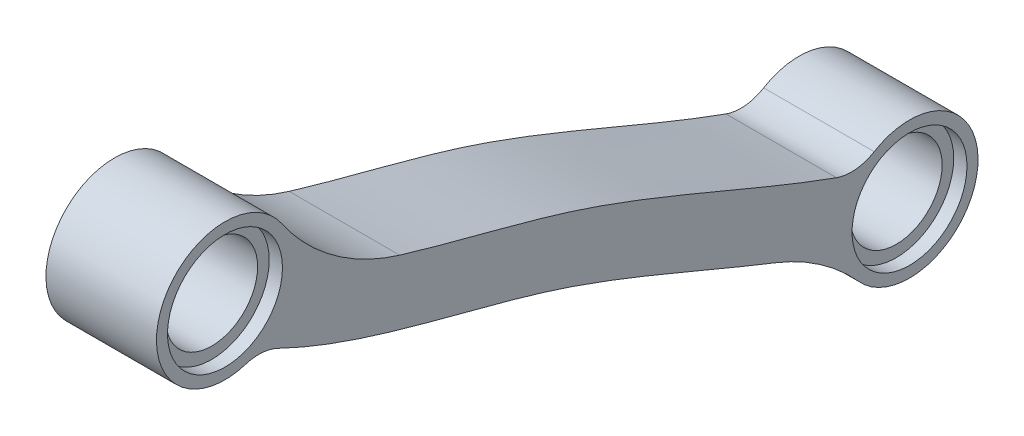
from build123d import *

# Parameters (mm, degrees)
BOSS_EXTRUDE1_START     = -2.5
BOSS_EXTRUDE1_OUTLINE_R = 2.075
BOSS_EXTRUDE1_DEPTH     = 5
FILLET1_R               = 10
FILLET2_R               = 2
SKETCH6_R               = 2.6
CUT_EXTRUDE3_DEPTH      = 0.6
CUT_EXTRUDE4_START      = -0.6
SKETCH7_R               = 2.6
CUT_EXTRUDE4_DEPTH      = 0.6


# Read off the part's stored shape, not the designer's step: Boss-Extrude1
with BuildPart() as part:
    # Boss-Extrude1 outline → Boss-Extrude1 (new body)
    with BuildSketch(Plane(origin=(0, 0, 0), x_dir=(0, 0, -1), z_dir=(1, 0, 0)).offset(BOSS_EXTRUDE1_START)):
        with BuildLine():
            add(Edge.make_bspline(
                [(-11.467428758, 5.351849738), (-9.981579618, 4.577281332), (-7.160995192, 3.544086065), (-2.770125707, 2.396619441), (1.347799898, 1.288727674), (5.338957915, -0.215867298), (9.160320461, -1.841071211), (12.08438205, -3.026761323), (13.750853903, -3.610645605), (14.156821659, -3.746175483)],
                knots=[0.086388593, 0.086388593, 0.086388593, 0.086388593, 0.25, 0.375, 0.5, 0.625, 0.75, 0.875, 0.915118366, 0.915118366, 0.915118366, 0.915118366], degree=3))
            ThreePointArc((-11.467428758, 5.351849738), (-17.182273296, 7.274593649), (-12.95766118, 2.972379718))
            add(Edge.make_bspline(
                [(-12.95766118, 2.972379718), (-12.493747453, 2.724314548), (-10.717791227, 1.858624399), (-7.52529105, 0.743374894), (-3.440580849, -0.32158746), (0.497631851, -1.383173076), (4.262093967, -2.802436867), (8.066886426, -4.418200775), (11.094789528, -5.649756293), (12.901972126, -6.280277824), (13.366776805, -6.434212154)],
                knots=[0.08026374, 0.08026374, 0.08026374, 0.08026374, 0.125, 0.25, 0.375, 0.5, 0.625, 0.75, 0.875, 0.917835676, 0.917835676, 0.917835676, 0.917835676], degree=3))
            ThreePointArc((13.366776805, -6.434212154), (19.389198985, -6.744151246), (14.156821659, -3.746175483))
        make_face()
        with Locations((16.415, -5.87)):
            Circle(BOSS_EXTRUDE1_OUTLINE_R, mode=Mode.SUBTRACT)
        with Locations((-14.555, 5.629165125)):
            Circle(BOSS_EXTRUDE1_OUTLINE_R, mode=Mode.SUBTRACT)
    extrude(amount=BOSS_EXTRUDE1_DEPTH)

    # Fillet1
    fillet1_edges = [part.edges().sort_by_distance(p)[0] for p in [
        (0, -6.434212154, -13.366776805),
        (0, 5.351849738, 11.467428758),
    ]]
    fillet(fillet1_edges, radius=FILLET1_R)

    # Fillet2
    fillet2_edges = [part.edges().sort_by_distance(p)[0] for p in [
        (0, -3.746175483, -14.156821659),
        (0, 2.972379718, 12.95766118),
    ]]
    fillet(fillet2_edges, radius=FILLET2_R)

    # Sketch6 → Cut-Extrude3 (cut)
    with BuildSketch(Plane(origin=(2.5, 0, 0), x_dir=(0, 0, -1), z_dir=(1, 0, 0))):
        with Locations((-14.555, 5.629165125)):
            Circle(SKETCH6_R)
        with Locations((16.415, -5.87)):
            Circle(SKETCH6_R)
    extrude(amount=-CUT_EXTRUDE3_DEPTH, mode=Mode.SUBTRACT)

    # Sketch7 → Cut-Extrude4 (cut)
    with BuildSketch(Plane.ZY.offset(2.5).offset(CUT_EXTRUDE4_START)):
        with Locations(Location((14.555, 5.629165125, 0), (0, 0, 180))):
            Circle(SKETCH7_R)
        with Locations(Location((-16.415, -5.87, 0), (0, 0, 180))):
            Circle(SKETCH7_R)
    extrude(amount=CUT_EXTRUDE4_DEPTH, mode=Mode.SUBTRACT)


solid = part.part
